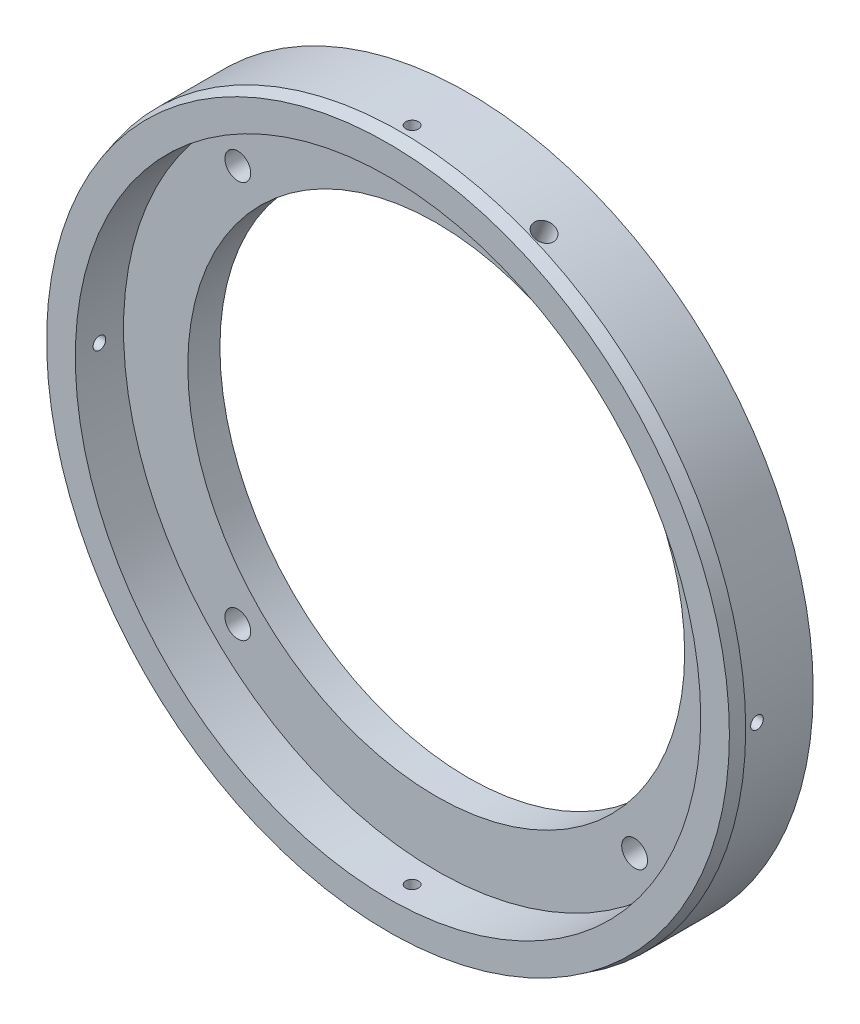
from build123d import *

# Parameters (mm, degrees)
SKETCH1_R                      = 68.1355
SKETCH1_R_2                    = 49.0855
EXTRUDE1_DEPTH                 = 15.875
SKETCH2_R                      = 61.7855
EXTRUDE2_DEPTH                 = 9.525
TAP_DRILL_FOR_10_32_TAP1_D     = 4.0386
TAP_DRILL_FOR_10_32_TAP1_DEPTH = 12.7
TAP_DRILL_FOR_10_32_TAP1_TIP   = 1.213317848
CIRPATTERN1_COUNT              = 4
CIRPATTERN2_COUNT              = 4
CHAMFER1_SIZE                  = 2.54
CHAMFER1_SIZE2                 = 0.680590949


with BuildPart() as part:
    # Sketch1 → Extrude1 (new body)
    with BuildSketch(Plane.XY):
        Circle(SKETCH1_R)
        Circle(SKETCH1_R_2, mode=Mode.SUBTRACT)
    extrude(amount=EXTRUDE1_DEPTH)

    # Sketch2 → Extrude2 (cut)
    with BuildSketch(Plane.XY.offset(15.875)):
        Circle(SKETCH2_R)
    extrude(amount=-EXTRUDE2_DEPTH, mode=Mode.SUBTRACT)

    # Tap Drill for #10-32 Tap1
    with Locations(Plane(origin=(26.074327006, 62.948993887, 11.1125), x_dir=(-0.9238795325112864, 0.38268343236509067, 0), z_dir=(0.38268343236509067, 0.9238795325112864, 0))):
        with Locations((0, 0)):
            Hole(TAP_DRILL_FOR_10_32_TAP1_D / 2, depth=TAP_DRILL_FOR_10_32_TAP1_DEPTH)
            with Locations((0, 0, -(TAP_DRILL_FOR_10_32_TAP1_DEPTH + TAP_DRILL_FOR_10_32_TAP1_TIP / 2))):  # 118° drill point
                Cone(0, TAP_DRILL_FOR_10_32_TAP1_D / 2, TAP_DRILL_FOR_10_32_TAP1_TIP, mode=Mode.SUBTRACT)

    # Sketch4 → M3x0.5 Tapped Hole1 (revolve, cut)
    with BuildSketch(Plane(origin=(0, 68.1355, 11.1125), x_dir=(0, 0, 1), z_dir=(1, 0, 0))):
        Polygon((0, 0), (0, 9.387075774), (1.25, 8.636), (1.25, 0), align=None)
    m3x0_5_tapped_hole1 = revolve(axis=Axis((0, 74.4855, 11.1125), (0, -1, 0)), mode=Mode.SUBTRACT)

    # CirPattern1: M3x0.5 Tapped Hole1 ×4 about axis
    cirpattern1_axis = Axis((0, 0, 15.875), (0, 0, -1))
    for i in range(1, CIRPATTERN1_COUNT):
        add(m3x0_5_tapped_hole1.rotate(cirpattern1_axis, i * 360 / CIRPATTERN1_COUNT), mode=Mode.SUBTRACT)

    # Sketch8 → 1/4-20 Tapped Hole1 (revolve, cut)
    with BuildSketch(Plane(origin=(39.198817968, 39.198817968, 11.1125), x_dir=(0, -1, 0), z_dir=(1, 0, 0))):
        Polygon((0, 0), (0, 18.043816902), (2.5527, 16.51), (2.5527, 0), align=None)
    f_1_4_20_tapped_hole1 = revolve(axis=Axis((39.198817968, 39.198817968, 17.4625), (0, 0, -1)), mode=Mode.SUBTRACT)

    # CirPattern2: 1/4-20 Tapped Hole1 ×4 about axis
    cirpattern2_axis = Axis((0, 0, 15.875), (0, 0, -1))
    for i in range(1, CIRPATTERN2_COUNT):
        add(f_1_4_20_tapped_hole1.rotate(cirpattern2_axis, i * 360 / CIRPATTERN2_COUNT), mode=Mode.SUBTRACT)

    # Chamfer1
    chamfer1_edges = [part.edges().sort_by_distance(p)[0] for p in [
        (-68.1355, 0, 15.875),
    ]]
    chamfer1_side = [part.faces().sort_by_distance(p)[0] for p in [
        (-68.1355, 0, 7.9375),
    ]]
    chamfer(chamfer1_edges, length=CHAMFER1_SIZE, length2=CHAMFER1_SIZE2, reference=chamfer1_side[0])


solid = part.part
